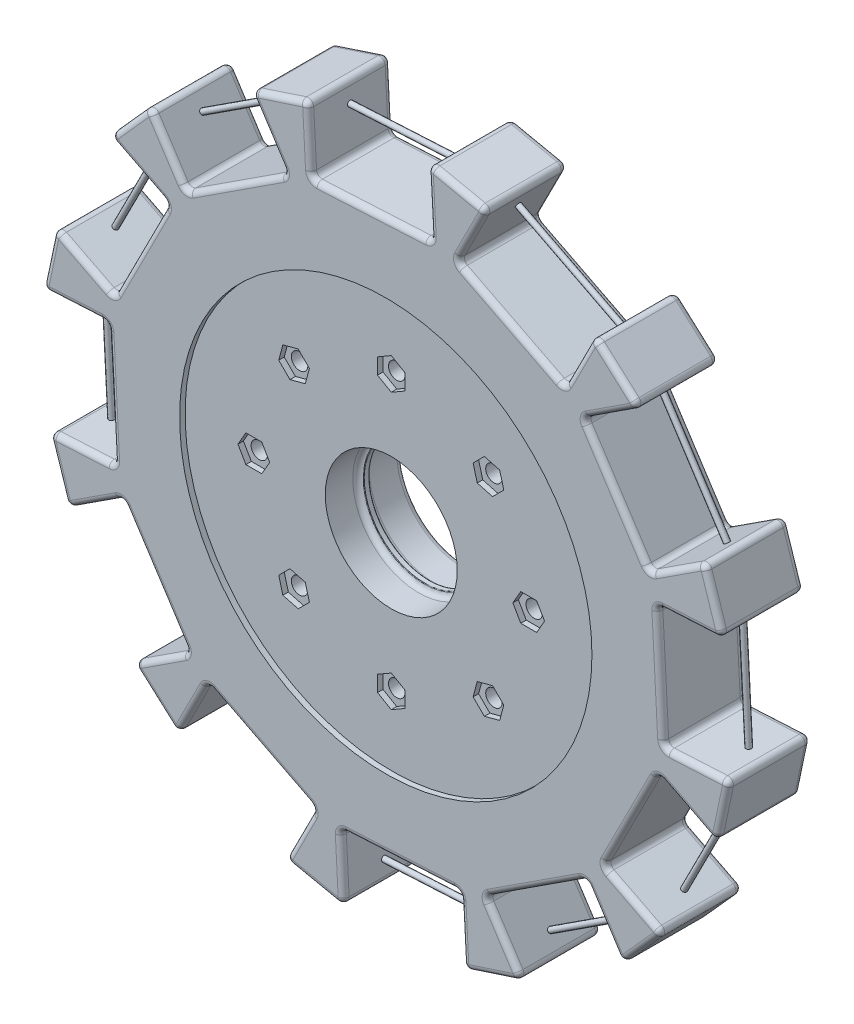
from build123d import *

# Parameters (mm, degrees)
BOSS_EXTRUDE1_DEPTH  = 15
SKETCH3_R            = 12
CUT_EXTRUDE1_DEPTH   = 7
CUT_EXTRUDE2_START   = -7
SKETCH4_R            = 12
CUT_EXTRUDE2_DEPTH   = 7
SKETCH5_R            = 11
CUT_EXTRUDE3_DEPTH   = 7
FILLET1_R            = 1
FILLET2_R            = 1
FILLET3_R            = 0.1
SKETCH6_R            = 1.5
CUT_EXTRUDE4_DEPTH   = 37
CUT_EXTRUDE5_DEPTH   = 2
CUT_EXTRUDE6_DEPTH   = 2
SKETCH9_R            = 0.5
BOSS_EXTRUDE2_DEPTH  = 23
SKETCH10_R           = 0.5
BOSS_EXTRUDE3_DEPTH  = 23
SKETCH11_R           = 0.5
BOSS_EXTRUDE4_DEPTH  = 23
SKETCH12_R           = 0.5
BOSS_EXTRUDE5_DEPTH  = 23
SKETCH13_R           = 0.5
BOSS_EXTRUDE6_DEPTH  = 23
SKETCH14_R           = 0.5
BOSS_EXTRUDE7_DEPTH  = 23
SKETCH15_R           = 0.5
BOSS_EXTRUDE8_DEPTH  = 23
SKETCH16_R           = 0.5
BOSS_EXTRUDE9_DEPTH  = 23
SKETCH17_R           = 0.5
BOSS_EXTRUDE10_DEPTH = 23
SKETCH18_R           = 0.5
BOSS_EXTRUDE11_DEPTH = 23
SKETCH19_R           = 0.5
BOSS_EXTRUDE12_DEPTH = 23
SKETCH20_R           = 0.5
BOSS_EXTRUDE13_DEPTH = 23
SKETCH23_R           = 37.5
CUT_EXTRUDE8_DEPTH   = 1
SKETCH24_R           = 1
BOSS_EXTRUDE14_DEPTH = 1
FILLET4_R            = 0.5
SKETCH25_R           = 1
CUT_EXTRUDE9_DEPTH   = 1
FILLET5_R            = 0.5


with BuildPart() as part:
    # Sketch1 → Boss-Extrude1 (new body)
    with BuildSketch(Plane.XY):
        with BuildLine():
            Line((-18.67460281, 48.693057371), (-23.963115728, 56.82298102))
            ThreePointArc((-23.963115728, 56.82298102), (-24.067993911, 57.700686954), (-23.435941035, 58.318648361))
            Line((-23.435941035, 58.318648361), (-15.41218335, 60.944964427))
            ThreePointArc((-15.41218335, 60.944964427), (-14.535909679, 60.819536384), (-14.102516823, 60.047682529))
            Line((-14.102516823, 60.047682529), (-13.586792283, 50.349545451))
            ThreePointArc((-13.586792283, 50.349545451), (-13.256763068, 49.658989765), (-12.535100564, 49.404059053))
            Line((-12.535100564, 49.404059053), (7.228361849, 50.455034357))
            ThreePointArc((7.228361849, 50.455034357), (7.918917534, 50.785063572), (8.173848247, 51.506726076))
            Line((8.173848247, 51.506726076), (7.658823536, 61.191702946))
            ThreePointArc((7.658823536, 61.191702946), (8.006849332, 62.004257673), (8.863203883, 62.223401512))
            Line((8.863203883, 62.223401512), (17.125139904, 60.485979101))
            ThreePointArc((17.125139904, 60.485979101), (17.821301143, 59.939218395), (17.810703439, 59.05407692))
            Line((17.810703439, 59.05407692), (13.408265453, 50.397381571))
            ThreePointArc((13.408265453, 50.397381571), (13.348801294, 49.634328197), (13.846313999, 49.052720472))
            Line((13.846313999, 49.052720472), (31.487462167, 40.081160577))
            ThreePointArc((31.487462167, 40.081160577), (32.250515541, 40.021696419), (32.832123266, 40.519209124))
            Line((32.832123266, 40.519209124), (37.228587219, 49.164157484))
            ThreePointArc((37.228587219, 49.164157484), (37.936263762, 49.693837622), (38.787460477, 49.455444478))
            Line((38.787460477, 49.455444478), (45.073795751, 43.819824522))
            ThreePointArc((45.073795751, 43.819824522), (45.403308716, 42.998235241), (44.951560097, 42.23697909))
            Line((44.951560097, 42.23697909), (36.810589288, 36.941279998))
            ThreePointArc((36.810589288, 36.941279998), (36.377565129, 36.310188471), (36.517619908, 35.557745054))
            Line((36.517619908, 35.557745054), (47.309522426, 18.967572189))
            ThreePointArc((47.309522426, 18.967572189), (47.940613953, 18.534548031), (48.693057371, 18.67460281))
            Line((48.693057371, 18.67460281), (56.82298102, 23.963115728))
            ThreePointArc((56.82298102, 23.963115728), (57.700686954, 24.067993911), (58.318648361, 23.435941035))
            Line((58.318648361, 23.435941035), (60.944964427, 15.41218335))
            ThreePointArc((60.944964427, 15.41218335), (60.819536384, 14.535909679), (60.047682529, 14.102516823))
            Line((60.047682529, 14.102516823), (50.349545451, 13.586792283))
            ThreePointArc((50.349545451, 13.586792283), (49.658989765, 13.256763068), (49.404059053, 12.535100564))
            Line((49.404059053, 12.535100564), (50.455034357, -7.228361849))
            ThreePointArc((50.455034357, -7.228361849), (50.785063572, -7.918917534), (51.506726076, -8.173848247))
            Line((51.506726076, -8.173848247), (61.191702946, -7.658823536))
            ThreePointArc((61.191702946, -7.658823536), (62.004257673, -8.006849332), (62.223401512, -8.863203883))
            Line((62.223401512, -8.863203883), (60.485979101, -17.125139904))
            ThreePointArc((60.485979101, -17.125139904), (59.939218395, -17.821301143), (59.05407692, -17.810703439))
            Line((59.05407692, -17.810703439), (50.397381571, -13.408265453))
            ThreePointArc((50.397381571, -13.408265453), (49.634328197, -13.348801294), (49.052720472, -13.846313999))
            Line((49.052720472, -13.846313999), (40.081160577, -31.487462167))
            ThreePointArc((40.081160577, -31.487462167), (40.021696419, -32.250515541), (40.519209124, -32.832123266))
            Line((40.519209124, -32.832123266), (49.164157484, -37.228587219))
            ThreePointArc((49.164157484, -37.228587219), (49.693837622, -37.936263762), (49.455444478, -38.787460477))
            Line((49.455444478, -38.787460477), (43.819824522, -45.073795751))
            ThreePointArc((43.819824522, -45.073795751), (42.998235241, -45.403308716), (42.23697909, -44.951560097))
            Line((42.23697909, -44.951560097), (36.941279998, -36.810589288))
            ThreePointArc((36.941279998, -36.810589288), (36.310188471, -36.377565129), (35.557745054, -36.517619908))
            Line((35.557745054, -36.517619908), (18.967572189, -47.309522426))
            ThreePointArc((18.967572189, -47.309522426), (18.534548031, -47.940613953), (18.67460281, -48.693057371))
            Line((18.67460281, -48.693057371), (23.963115728, -56.82298102))
            ThreePointArc((23.963115728, -56.82298102), (24.067993911, -57.700686954), (23.435941035, -58.318648361))
            Line((23.435941035, -58.318648361), (15.41218335, -60.944964427))
            ThreePointArc((15.41218335, -60.944964427), (14.535909679, -60.819536384), (14.102516823, -60.047682529))
            Line((14.102516823, -60.047682529), (13.586792283, -50.349545451))
            ThreePointArc((13.586792283, -50.349545451), (13.256763068, -49.658989765), (12.535100564, -49.404059053))
            Line((12.535100564, -49.404059053), (-7.228361849, -50.455034357))
            ThreePointArc((-7.228361849, -50.455034357), (-7.918917534, -50.785063572), (-8.173848247, -51.506726076))
            Line((-8.173848247, -51.506726076), (-7.658823536, -61.191702946))
            ThreePointArc((-7.658823536, -61.191702946), (-8.006849332, -62.004257673), (-8.863203883, -62.223401512))
            Line((-8.863203883, -62.223401512), (-17.125139904, -60.485979101))
            ThreePointArc((-17.125139904, -60.485979101), (-17.821301143, -59.939218395), (-17.810703439, -59.05407692))
            Line((-17.810703439, -59.05407692), (-13.408265453, -50.397381571))
            ThreePointArc((-13.408265453, -50.397381571), (-13.348801294, -49.634328197), (-13.846313999, -49.052720472))
            Line((-13.846313999, -49.052720472), (-31.487462167, -40.081160577))
            ThreePointArc((-31.487462167, -40.081160577), (-32.250515541, -40.021696419), (-32.832123266, -40.519209124))
            Line((-32.832123266, -40.519209124), (-37.228587219, -49.164157484))
            ThreePointArc((-37.228587219, -49.164157484), (-37.936263762, -49.693837622), (-38.787460477, -49.455444478))
            Line((-38.787460477, -49.455444478), (-45.073795751, -43.819824522))
            ThreePointArc((-45.073795751, -43.819824522), (-45.403308716, -42.998235241), (-44.951560097, -42.23697909))
            Line((-44.951560097, -42.23697909), (-36.810589288, -36.941279998))
            ThreePointArc((-36.810589288, -36.941279998), (-36.377565129, -36.310188471), (-36.517619908, -35.557745054))
            Line((-36.517619908, -35.557745054), (-47.309522426, -18.967572189))
            ThreePointArc((-47.309522426, -18.967572189), (-47.940613953, -18.534548031), (-48.693057371, -18.67460281))
            Line((-48.693057371, -18.67460281), (-56.82298102, -23.963115728))
            ThreePointArc((-56.82298102, -23.963115728), (-57.700686954, -24.067993911), (-58.318648361, -23.435941035))
            Line((-58.318648361, -23.435941035), (-60.944964427, -15.41218335))
            ThreePointArc((-60.944964427, -15.41218335), (-60.819536384, -14.535909679), (-60.047682529, -14.102516823))
            Line((-60.047682529, -14.102516823), (-50.349545451, -13.586792283))
            ThreePointArc((-50.349545451, -13.586792283), (-49.658989765, -13.256763068), (-49.404059053, -12.535100564))
            Line((-49.404059053, -12.535100564), (-50.455034357, 7.228361849))
            ThreePointArc((-50.455034357, 7.228361849), (-50.785063572, 7.918917534), (-51.506726076, 8.173848247))
            Line((-51.506726076, 8.173848247), (-61.191702946, 7.658823536))
            ThreePointArc((-61.191702946, 7.658823536), (-62.004257673, 8.006849332), (-62.223401512, 8.863203883))
            Line((-62.223401512, 8.863203883), (-60.485979101, 17.125139904))
            ThreePointArc((-60.485979101, 17.125139904), (-59.939218395, 17.821301143), (-59.05407692, 17.810703439))
            Line((-59.05407692, 17.810703439), (-50.397381571, 13.408265453))
            ThreePointArc((-50.397381571, 13.408265453), (-49.634328197, 13.348801294), (-49.052720472, 13.846313999))
            Line((-49.052720472, 13.846313999), (-40.081160577, 31.487462167))
            ThreePointArc((-40.081160577, 31.487462167), (-40.021696419, 32.250515541), (-40.519209124, 32.832123266))
            Line((-40.519209124, 32.832123266), (-49.164157484, 37.228587219))
            ThreePointArc((-49.164157484, 37.228587219), (-49.693837622, 37.936263762), (-49.455444478, 38.787460477))
            Line((-49.455444478, 38.787460477), (-43.819824522, 45.073795751))
            ThreePointArc((-43.819824522, 45.073795751), (-42.998235241, 45.403308716), (-42.23697909, 44.951560097))
            Line((-42.23697909, 44.951560097), (-36.941279998, 36.810589288))
            ThreePointArc((-36.941279998, 36.810589288), (-36.310188471, 36.377565129), (-35.557745054, 36.517619908))
            Line((-35.557745054, 36.517619908), (-18.967572189, 47.309522426))
            ThreePointArc((-18.967572189, 47.309522426), (-18.534548031, 47.940613953), (-18.67460281, 48.693057371))
        make_face()
    extrude(amount=BOSS_EXTRUDE1_DEPTH)

    # Sketch3 → Cut-Extrude1 (cut)
    with BuildSketch(Plane.XY.offset(15)):
        Circle(SKETCH3_R)
    extrude(amount=-CUT_EXTRUDE1_DEPTH, mode=Mode.SUBTRACT)

    # Sketch4 → Cut-Extrude2 (cut)
    with BuildSketch(Plane(origin=(0, 0, 0), x_dir=(-1, 0, 0), z_dir=(0, 0, -1)).offset(CUT_EXTRUDE2_START)):
        with Locations(Location((0, 0, 0), (0, 0, 180))):
            Circle(SKETCH4_R)
    extrude(amount=CUT_EXTRUDE2_DEPTH, mode=Mode.SUBTRACT)

    # Sketch5 → Cut-Extrude3 (cut)
    with BuildSketch(Plane(origin=(0, 0, 7), x_dir=(-1, 0, 0), z_dir=(0, 0, -1))):
        Circle(SKETCH5_R)
    extrude(amount=-CUT_EXTRUDE3_DEPTH, mode=Mode.SUBTRACT)

    # Fillet1
    fillet1_edges = [part.edges().sort_by_distance(p)[0] for p in [
        (49.658989765, 13.256763068, 0),
        (49.929546705, 2.653369357, 0),
        (-36.377565129, -36.310188471, 15),
        (50.785063572, -7.918917534, 0),
        (56.349214511, -7.916335891, 0),
        (62.004257673, -8.006849332, 0),
        (61.354690307, -12.994171894, 0),
        (59.939218395, -17.821301143, 0),
        (54.725729245, -15.609484446, 0),
        (49.634328197, -13.348801294, 0),
        (44.566940525, -22.666888083, 0),
        (40.021696419, -32.250515541, 0),
        (44.841683304, -35.030355242, 0),
        (-40.881074693, -39.589129544, 15),
        (49.693837622, -37.936263762, 0),
        (46.6376345, -41.930628114, 0),
        (42.998235241, -45.403308716, 0),
        (39.589129544, -40.881074693, 0),
        (36.310188471, -36.377565129, 0),
        (27.262658622, -41.913571167, 0),
        (18.534548031, -47.940613953, 0),
        (21.318859269, -52.758019195, 0),
        (24.067993911, -57.700686954, 0),
        (19.424062192, -59.631806394, 0),
        (-45.403308716, -42.998235241, 15),
        (14.535909679, -60.819536384, 0),
        (13.844654553, -55.19861399, 0),
        (13.256763068, -49.658989765, 0),
        (2.653369357, -49.929546705, 0),
        (-7.918917534, -50.785063572, 0),
        (-7.916335891, -56.349214511, 0),
        (-8.006849332, -62.004257673, 0),
        (-12.994171894, -61.354690307, 0),
        (-17.821301143, -59.939218395, 0),
        (-15.609484446, -54.725729245, 0),
        (-41.930628114, -46.6376345, 15),
        (-13.348801294, -49.634328197, 0),
        (-22.666888083, -44.566940525, 0),
        (-32.250515541, -40.021696419, 0),
        (-35.030355242, -44.841683304, 0),
        (-37.936263762, -49.693837622, 0),
        (-41.930628114, -46.6376345, 0),
        (-45.403308716, -42.998235241, 0),
        (-40.881074693, -39.589129544, 0),
        (-36.377565129, -36.310188471, 0),
        (-41.913571167, -27.262658622, 0),
        (-37.936263762, -49.693837622, 15),
        (-47.940613953, -18.534548031, 0),
        (-52.758019195, -21.318859269, 0),
        (-57.700686954, -24.067993911, 0),
        (-59.631806394, -19.424062192, 0),
        (-60.819536384, -14.535909679, 0),
        (-55.19861399, -13.844654553, 0),
        (-49.658989765, -13.256763068, 0),
        (-49.929546705, -2.653369357, 0),
        (-50.785063572, 7.918917534, 0),
        (-56.349214511, 7.916335891, 0),
        (-35.030355242, -44.841683304, 15),
        (-62.004257673, 8.006849332, 0),
        (-61.354690307, 12.994171894, 0),
        (-59.939218395, 17.821301143, 0),
        (-54.725729245, 15.609484446, 0),
        (-49.634328197, 13.348801294, 0),
        (-44.566940525, 22.666888083, 0),
        (-40.021696419, 32.250515541, 0),
        (-44.841683304, 35.030355242, 0),
        (-49.693837622, 37.936263762, 0),
        (-46.6376345, 41.930628114, 0),
        (-32.250515541, -40.021696419, 15),
        (-42.998235241, 45.403308716, 0),
        (-39.589129544, 40.881074693, 0),
        (-36.310188471, 36.377565129, 0),
        (-22.666888083, -44.566940525, 15),
        (-42.998235241, 45.403308716, 15),
        (-13.348801294, -49.634328197, 15),
        (-15.609484446, -54.725729245, 15),
        (-17.821301143, -59.939218395, 15),
        (-12.994171894, -61.354690307, 15),
        (-8.006849332, -62.004257673, 15),
        (-7.916335891, -56.349214511, 15),
        (-7.918917534, -50.785063572, 15),
        (2.653369357, -49.929546705, 15),
        (13.256763068, -49.658989765, 15),
        (13.844654553, -55.19861399, 15),
        (-46.6376345, 41.930628114, 15),
        (14.535909679, -60.819536384, 15),
        (19.424062192, -59.631806394, 15),
        (24.067993911, -57.700686954, 15),
        (21.318859269, -52.758019195, 15),
        (18.534548031, -47.940613953, 15),
        (27.262658622, -41.913571167, 15),
        (36.310188471, -36.377565129, 15),
        (39.589129544, -40.881074693, 15),
        (42.998235241, -45.403308716, 15),
        (46.6376345, -41.930628114, 15),
        (-49.693837622, 37.936263762, 15),
        (49.693837622, -37.936263762, 15),
        (44.841683304, -35.030355242, 15),
        (40.021696419, -32.250515541, 15),
        (44.566940525, -22.666888083, 15),
        (49.634328197, -13.348801294, 15),
        (54.725729245, -15.609484446, 15),
        (59.939218395, -17.821301143, 15),
        (61.354690307, -12.994171894, 15),
        (62.004257673, -8.006849332, 15),
        (56.349214511, -7.916335891, 15),
        (-44.841683304, 35.030355242, 15),
        (50.785063572, -7.918917534, 15),
        (-12, 0, 15),
        (49.929546705, 2.653369357, 15),
        (-12, 0, 0),
        (49.658989765, 13.256763068, 15),
        (55.19861399, 13.844654553, 15),
        (60.819536384, 14.535909679, 15),
        (59.631806394, 19.424062192, 15),
        (57.700686954, 24.067993911, 15),
        (52.758019195, 21.318859269, 15),
        (47.940613953, 18.534548031, 15),
        (41.913571167, 27.262658622, 15),
        (-40.021696419, 32.250515541, 15),
        (36.377565129, 36.310188471, 15),
        (40.881074693, 39.589129544, 15),
        (45.403308716, 42.998235241, 15),
        (41.930628114, 46.6376345, 15),
        (37.936263762, 49.693837622, 15),
        (35.030355242, 44.841683304, 15),
        (32.250515541, 40.021696419, 15),
        (22.666888083, 44.566940525, 15),
        (13.348801294, 49.634328197, 15),
        (15.609484446, 54.725729245, 15),
        (-44.566940525, 22.666888083, 15),
        (17.821301143, 59.939218395, 15),
        (12.994171894, 61.354690307, 15),
        (8.006849332, 62.004257673, 15),
        (7.916335891, 56.349214511, 15),
        (7.918917534, 50.785063572, 15),
        (-2.653369357, 49.929546705, 15),
        (-13.256763068, 49.658989765, 15),
        (-13.844654553, 55.19861399, 15),
        (-14.535909679, 60.819536384, 15),
        (-19.424062192, 59.631806394, 15),
        (-49.634328197, 13.348801294, 15),
        (-24.067993911, 57.700686954, 15),
        (-21.318859269, 52.758019195, 15),
        (-18.534548031, 47.940613953, 15),
        (-27.262658622, 41.913571167, 15),
        (-54.725729245, 15.609484446, 15),
        (-59.939218395, 17.821301143, 15),
        (-61.354690307, 12.994171894, 15),
        (-36.310188471, 36.377565129, 15),
        (-62.004257673, 8.006849332, 15),
        (-56.349214511, 7.916335891, 15),
        (-50.785063572, 7.918917534, 15),
        (-49.929546705, -2.653369357, 15),
        (-49.658989765, -13.256763068, 15),
        (-55.19861399, -13.844654553, 15),
        (-60.819536384, -14.535909679, 15),
        (-59.631806394, -19.424062192, 15),
        (-57.700686954, -24.067993911, 15),
        (-27.262658622, 41.913571167, 0),
        (-18.534548031, 47.940613953, 0),
        (-21.318859269, 52.758019195, 0),
        (-52.758019195, -21.318859269, 15),
        (-24.067993911, 57.700686954, 0),
        (-19.424062192, 59.631806394, 0),
        (-14.535909679, 60.819536384, 0),
        (-39.589129544, 40.881074693, 15),
        (-13.844654553, 55.19861399, 0),
        (-13.256763068, 49.658989765, 0),
        (-2.653369357, 49.929546705, 0),
        (7.918917534, 50.785063572, 0),
        (7.916335891, 56.349214511, 0),
        (8.006849332, 62.004257673, 0),
        (12.994171894, 61.354690307, 0),
        (-47.940613953, -18.534548031, 15),
        (17.821301143, 59.939218395, 0),
        (15.609484446, 54.725729245, 0),
        (13.348801294, 49.634328197, 0),
        (22.666888083, 44.566940525, 0),
        (32.250515541, 40.021696419, 0),
        (35.030355242, 44.841683304, 0),
        (37.936263762, 49.693837622, 0),
        (41.930628114, 46.6376345, 0),
        (45.403308716, 42.998235241, 0),
        (40.881074693, 39.589129544, 0),
        (-41.913571167, -27.262658622, 15),
        (36.377565129, 36.310188471, 0),
        (41.913571167, 27.262658622, 0),
        (47.940613953, 18.534548031, 0),
        (52.758019195, 21.318859269, 0),
        (57.700686954, 24.067993911, 0),
        (59.631806394, 19.424062192, 0),
        (60.819536384, 14.535909679, 0),
        (55.19861399, 13.844654553, 0),
    ]]
    fillet(fillet1_edges, radius=FILLET1_R)

    # Fillet2
    fillet2_edges = [part.edges().sort_by_distance(p)[0] for p in [
        (-12, 0, 8),
        (-12, 0, 7),
    ]]
    fillet(fillet2_edges, radius=FILLET2_R - 0.0001)  # a hair under: the kernel refuses the full size

    # Fillet3
    fillet3_edges = [part.edges().sort_by_distance(p)[0] for p in [
        (11, 0, 8),
        (11, 0, 7),
    ]]
    fillet(fillet3_edges, radius=FILLET3_R)

    # Sketch6 → Cut-Extrude4 (cut)
    with BuildSketch(Plane(origin=(0, 0, 0), x_dir=(-1, 0, 0), z_dir=(0, 0, -1))):
        with Locations((0, 25)):
            Circle(SKETCH6_R)
        with Locations((17.67766953, 17.67766953)):
            Circle(SKETCH6_R)
        with Locations((25, 0)):
            Circle(SKETCH6_R)
        with Locations((17.67766953, -17.67766953)):
            Circle(SKETCH6_R)
        with Locations((0, -25)):
            Circle(SKETCH6_R)
        with Locations((-17.67766953, -17.67766953)):
            Circle(SKETCH6_R)
        with Locations((-25, 0)):
            Circle(SKETCH6_R)
        with Locations((-17.67766953, 17.67766953)):
            Circle(SKETCH6_R)
    extrude(amount=-CUT_EXTRUDE4_DEPTH, mode=Mode.SUBTRACT)

    # Sketch7 → Cut-Extrude5 (cut)
    with BuildSketch(Plane(origin=(0, 0, 0), x_dir=(-1, 0, 0), z_dir=(0, 0, -1))):
        Polygon((15.636428077, 15.636428077), (18.424815756, 14.889281851), (20.466057209, 16.930523303), (19.718910982, 19.718910982), (16.930523303, 20.466057209), (14.889281851, 18.424815756), align=None)
        Polygon((0, 22.113248654), (2.5, 23.556624327), (2.5, 26.443375673), (0, 27.886751346), (-2.5, 26.443375673), (-2.5, 23.556624327), align=None)
        Polygon((22.113248654, 0), (23.556624327, -2.5), (26.443375673, -2.5), (27.886751346, 0), (26.443375673, 2.5), (23.556624327, 2.5), align=None)
        Polygon((15.636428077, -15.636428077), (14.889281851, -18.424815756), (16.930523303, -20.466057209), (19.718910982, -19.718910982), (20.466057209, -16.930523303), (18.424815756, -14.889281851), align=None)
        Polygon((0, -22.113248654), (-2.5, -23.556624327), (-2.5, -26.443375673), (0, -27.886751346), (2.5, -26.443375673), (2.5, -23.556624327), align=None)
        Polygon((-15.636428077, -15.636428077), (-18.424815756, -14.889281851), (-20.466057209, -16.930523303), (-19.718910982, -19.718910982), (-16.930523303, -20.466057209), (-14.889281851, -18.424815756), align=None)
        Polygon((-22.113248654, 0), (-23.556624327, 2.5), (-26.443375673, 2.5), (-27.886751346, 0), (-26.443375673, -2.5), (-23.556624327, -2.5), align=None)
        Polygon((-15.636428077, 15.636428077), (-14.889281851, 18.424815756), (-16.930523303, 20.466057209), (-19.718910982, 19.718910982), (-20.466057209, 16.930523303), (-18.424815756, 14.889281851), align=None)
    extrude(amount=-CUT_EXTRUDE5_DEPTH, mode=Mode.SUBTRACT)

    # Sketch8 → Cut-Extrude6 (cut)
    with BuildSketch(Plane.XY.offset(15)):
        Polygon((15.636428077, 15.636428077), (18.424815756, 14.889281851), (20.466057209, 16.930523303), (19.718910982, 19.718910982), (16.930523303, 20.466057209), (14.889281851, 18.424815756), align=None)
        Polygon((0, 22.113248654), (2.5, 23.556624327), (2.5, 26.443375673), (0, 27.886751346), (-2.5, 26.443375673), (-2.5, 23.556624327), align=None)
        Polygon((22.113248654, 0), (23.556624327, -2.5), (26.443375673, -2.5), (27.886751346, 0), (26.443375673, 2.5), (23.556624327, 2.5), align=None)
        Polygon((15.636428077, -15.636428077), (14.889281851, -18.424815756), (16.930523303, -20.466057209), (19.718910982, -19.718910982), (20.466057209, -16.930523303), (18.424815756, -14.889281851), align=None)
        Polygon((0, -22.113248654), (-2.5, -23.556624327), (-2.5, -26.443375673), (0, -27.886751346), (2.5, -26.443375673), (2.5, -23.556624327), align=None)
        Polygon((-15.636428077, -15.636428077), (-18.424815756, -14.889281851), (-20.466057209, -16.930523303), (-19.718910982, -19.718910982), (-16.930523303, -20.466057209), (-14.889281851, -18.424815756), align=None)
        Polygon((-22.113248654, 0), (-23.556624327, 2.5), (-26.443375673, 2.5), (-27.886751346, 0), (-26.443375673, -2.5), (-23.556624327, -2.5), align=None)
        Polygon((-15.636428077, 15.636428077), (-14.889281851, 18.424815756), (-16.930523303, 20.466057209), (-19.718910982, 19.718910982), (-20.466057209, 16.930523303), (-18.424815756, 14.889281851), align=None)
    extrude(amount=-CUT_EXTRUDE6_DEPTH, mode=Mode.SUBTRACT)

    # Sketch9 → Boss-Extrude2 (add)
    with BuildSketch(Plane(origin=(-5.94027098, 9.131858099, 0), x_dir=(0.8382521621149944, 0.5452827823336597, 0), z_dir=(0.5452827823336597, -0.8382521621149944, 0))):
        with Locations(Location((58.024959321, 7.5, 0), (0, 0, 180))):
            Circle(SKETCH9_R)
    extrude(amount=BOSS_EXTRUDE2_DEPTH)

    # Sketch10 → Boss-Extrude3 (add)
    with BuildSketch(Plane(origin=(-0.578496524, 10.878556588, 0), x_dir=(0.9985890583356466, 0.05310266068971212, 0), z_dir=(0.053102660689712124, -0.9985890583356467, 0))):
        with Locations(Location((58.024959321, 7.5, 0), (0, 0, 180))):
            Circle(SKETCH10_R)
    extrude(amount=BOSS_EXTRUDE3_DEPTH)

    # Sketch11 → Boss-Extrude4 (add)
    with BuildSketch(Plane(origin=(4.938285608, 9.710354623, 0), x_dir=(0.8913548228047069, -0.45330627600198686, 0), z_dir=(-0.45330627600198686, -0.8913548228047069, 0))):
        with Locations(Location((58.024959321, 7.5, 0), (0, 0, 180))):
            Circle(SKETCH11_R)
    extrude(amount=BOSS_EXTRUDE4_DEPTH)

    # Sketch12 → Boss-Extrude5 (add)
    with BuildSketch(Plane(origin=(9.131858099, 5.94027098, 0), x_dir=(0, 0, 1), z_dir=(-0.8382521621149936, -0.5452827823336607, 0))):
        with Locations(Location((7.5, -58.024959321, 0), (0, 0, 90))):
            Circle(SKETCH12_R)
    extrude(amount=BOSS_EXTRUDE5_DEPTH)

    # Sketch13 → Boss-Extrude6 (add)
    with BuildSketch(Plane(origin=(10.878556588, 0.578496524, 0), x_dir=(0, 0, 1), z_dir=(-0.9985890583356466, -0.053102660689712554, 0))):
        with Locations(Location((7.5, -58.024959321, 0), (0, 0, 90))):
            Circle(SKETCH13_R)
    extrude(amount=BOSS_EXTRUDE6_DEPTH)

    # Sketch14 → Boss-Extrude7 (add)
    with BuildSketch(Plane(origin=(9.710354623, -4.938285608, 0), x_dir=(0, 0, 1), z_dir=(-0.8913548228047072, 0.45330627600198636, 0))):
        with Locations(Location((7.5, -58.024959321, 0), (0, 0, 90))):
            Circle(SKETCH14_R)
    extrude(amount=BOSS_EXTRUDE7_DEPTH)

    # Sketch15 → Boss-Extrude8 (add)
    with BuildSketch(Plane(origin=(5.94027098, -9.131858099, 0), x_dir=(0.8382521621149944, 0.5452827823336596, 0), z_dir=(-0.5452827823336596, 0.8382521621149944, 0))):
        with Locations((-58.024959321, -7.5)):
            Circle(SKETCH15_R)
    extrude(amount=BOSS_EXTRUDE8_DEPTH)

    # Sketch16 → Boss-Extrude9 (add)
    with BuildSketch(Plane(origin=(0.578496524, -10.878556588, 0), x_dir=(0.9985890583356466, 0.053102660689712505, 0), z_dir=(-0.0531026606897125, 0.9985890583356465, 0))):
        with Locations((-58.024959321, -7.5)):
            Circle(SKETCH16_R)
    extrude(amount=BOSS_EXTRUDE9_DEPTH)

    # Sketch17 → Boss-Extrude10 (add)
    with BuildSketch(Plane(origin=(-4.938285608, -9.710354623, 0), x_dir=(0.8913548228047073, -0.45330627600198614, 0), z_dir=(0.4533062760019862, 0.8913548228047075, 0))):
        with Locations((-58.024959321, -7.5)):
            Circle(SKETCH17_R)
    extrude(amount=BOSS_EXTRUDE10_DEPTH)

    # Sketch18 → Boss-Extrude11 (add)
    with BuildSketch(Plane(origin=(-9.131858099, -5.94027098, 0), x_dir=(0, 0, -1), z_dir=(0.8382521621149949, 0.5452827823336589, 0))):
        with Locations(Location((-7.5, 58.024959321, 0), (0, 0, 270))):
            Circle(SKETCH18_R)
    extrude(amount=BOSS_EXTRUDE11_DEPTH)

    # Sketch19 → Boss-Extrude12 (add)
    with BuildSketch(Plane(origin=(-10.878556588, -0.578496524, 0), x_dir=(0, 0, -1), z_dir=(0.9985890583356465, 0.05310266068971475, 0))):
        with Locations(Location((-7.5, 58.024959321, 0), (0, 0, 270))):
            Circle(SKETCH19_R)
    extrude(amount=BOSS_EXTRUDE12_DEPTH)

    # Sketch20 → Boss-Extrude13 (add)
    with BuildSketch(Plane(origin=(-9.710354623, 4.938285608, 0), x_dir=(0, 0, -1), z_dir=(0.8913548228047082, -0.4533062760019845, 0))):
        with Locations(Location((-7.5, 58.024959321, 0), (0, 0, 270))):
            Circle(SKETCH20_R)
    extrude(amount=BOSS_EXTRUDE13_DEPTH)

    # Sketch23 → Cut-Extrude8 (cut)
    with BuildSketch(Plane.XY.offset(15)):
        Circle(SKETCH23_R)
    extrude(amount=-CUT_EXTRUDE8_DEPTH, mode=Mode.SUBTRACT)

    # Sketch24 → Boss-Extrude14 (add)
    with BuildSketch(Plane(origin=(0, 0, 0), x_dir=(-1, 0, 0), z_dir=(0, 0, -1))):
        with Locations((-18.13334571, 35.653636187)):
            Circle(SKETCH24_R)
    extrude(amount=BOSS_EXTRUDE14_DEPTH)

    # Fillet4
    fillet4_edges = [part.edges().sort_by_distance(p)[0] for p in [
        (19.13334571, 35.653636187, -1),
    ]]
    fillet(fillet4_edges, radius=FILLET4_R)

    # Sketch25 → Cut-Extrude9 (cut)
    with BuildSketch(Plane(origin=(0, 0, 0), x_dir=(-1, 0, 0), z_dir=(0, 0, -1))):
        with Locations((-26.744037978, 29.744855566)):
            Circle(SKETCH25_R)
    extrude(amount=-CUT_EXTRUDE9_DEPTH, mode=Mode.SUBTRACT)

    # Fillet5
    fillet5_edges = [part.edges().sort_by_distance(p)[0] for p in [
        (27.744037978, 29.744855566, 1),
    ]]
    fillet(fillet5_edges, radius=FILLET5_R)


solid = part.part
